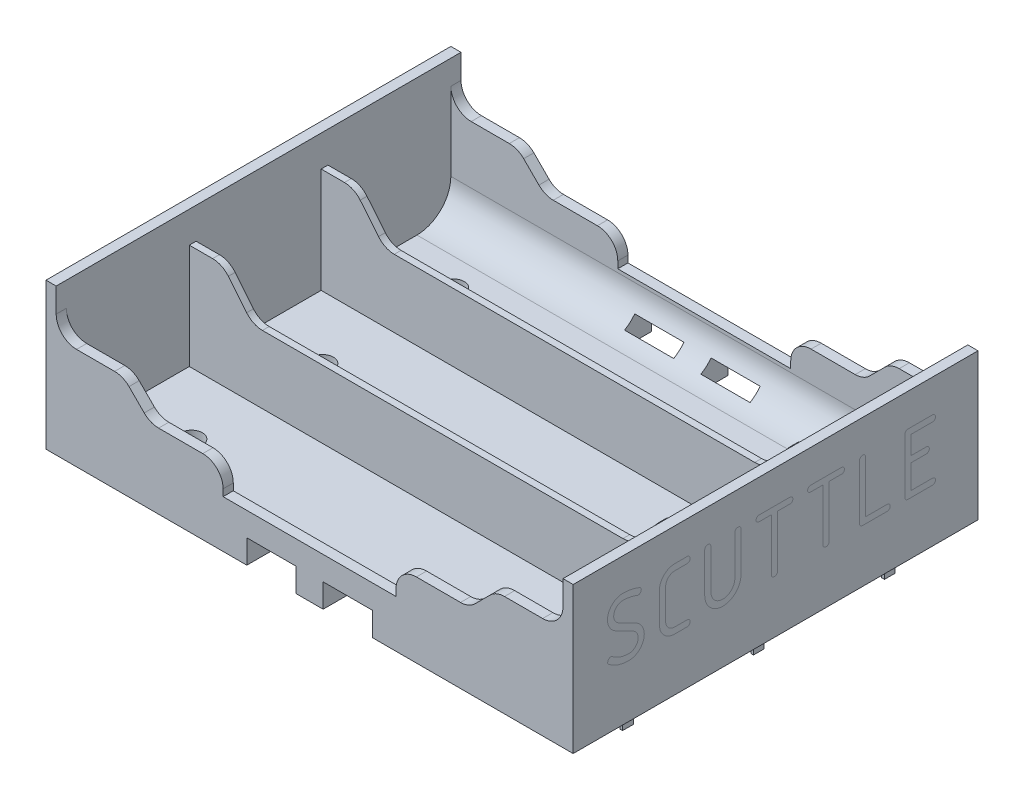
from build123d import *

# Parameters (mm, degrees)
SKETCH1_W                 = 77.724
SKETCH1_H                 = 59.69
BOSS_EXTRUDE1_DEPTH       = 21.59
SKETCH2_W                 = 0.4064
SKETCH2_H                 = 1.5748
BOSS_EXTRUDE2_DEPTH       = 3.175
SKETCH3_W                 = 0.4064
SKETCH3_H                 = 1.5748
BOSS_EXTRUDE3_DEPTH       = 3.175
SKETCH4_W                 = 0.4064
SKETCH4_H                 = 1.5748
BOSS_EXTRUDE4_DEPTH       = 3.175
SKETCH5_W                 = 0.4064
SKETCH5_H                 = 1.5748
BOSS_EXTRUDE5_DEPTH       = 3.175
SKETCH6_W                 = 0.4064
SKETCH6_H                 = 1.5748
BOSS_EXTRUDE6_DEPTH       = 3.175
SKETCH7_W                 = 0.4064
SKETCH7_H                 = 1.5748
BOSS_EXTRUDE7_DEPTH       = 3.175
F_4_CLEARANCE_HOLE1_D     = 3.2004
F_4_CLEARANCE_HOLE1_DEPTH = 5.08
SHELL1_START              = 1.5
SHELL1_OUTLINE_W          = 74.724
SHELL1_OUTLINE_H          = 56.69
SHELL1_OUTLINE_R          = 3.1002
SHELL1_DEPTH              = 20.09
SHELL1_START_2            = 6.58
SHELL1_2_OUTLINE_R        = 3.1002
SHELL1_2_DEPTH            = 15.01
FILLET1_R                 = 5
CUT_EXTRUDE3_DEPTH        = 75.426334345
SKETCH11_W                = 74.724
SKETCH11_H                = 46.69
CUT_EXTRUDE4_DEPTH        = 53.958353156
SKETCH12_W                = 74.724
SKETCH12_H                = 1
BOSS_EXTRUDE8_DEPTH       = 15.5
CUT_EXTRUDE5_REACH        = 61.182
FILLET2_R                 = 3
SKETCH14_R                = 1.905686258
CUT_EXTRUDE6_DEPTH        = 0.2
LPATTERN1_COUNT           = 3
LPATTERN1_PITCH           = 17.5
SKETCH16_W                = 7.25
SKETCH16_H                = 4
CUT_EXTRUDE7_DEPTH        = 3.5


# Read off the part's stored shape, not the designer's step: Shell1
with BuildPart() as part:
    # Sketch1 → Boss-Extrude1 (new body)
    with BuildSketch(Plane.XZ):
        Rectangle(SKETCH1_W, SKETCH1_H)
    extrude(amount=-BOSS_EXTRUDE1_DEPTH)

    # Sketch2 → Boss-Extrude2 (add)
    with BuildSketch(Plane.XZ):
        with Locations((-36.195, 0)):
            Rectangle(SKETCH2_W, SKETCH2_H)
    extrude(amount=BOSS_EXTRUDE2_DEPTH)

    # Sketch3 → Boss-Extrude3 (add)
    with BuildSketch(Plane.XZ):
        with Locations((36.195, 0)):
            Rectangle(SKETCH3_W, SKETCH3_H)
    extrude(amount=BOSS_EXTRUDE3_DEPTH)

    # Sketch4 → Boss-Extrude4 (add)
    with BuildSketch(Plane.XZ):
        with Locations((-36.195, 19.304)):
            Rectangle(SKETCH4_W, SKETCH4_H)
    extrude(amount=BOSS_EXTRUDE4_DEPTH)

    # Sketch5 → Boss-Extrude5 (add)
    with BuildSketch(Plane.XZ):
        with Locations((36.195, 19.304)):
            Rectangle(SKETCH5_W, SKETCH5_H)
    extrude(amount=BOSS_EXTRUDE5_DEPTH)

    # Sketch6 → Boss-Extrude6 (add)
    with BuildSketch(Plane.XZ):
        with Locations((36.195, -19.304)):
            Rectangle(SKETCH6_W, SKETCH6_H)
    extrude(amount=BOSS_EXTRUDE6_DEPTH)

    # Sketch7 → Boss-Extrude7 (add)
    with BuildSketch(Plane.XZ):
        with Locations((-36.195, -19.304)):
            Rectangle(SKETCH7_W, SKETCH7_H)
    extrude(amount=BOSS_EXTRUDE7_DEPTH)

    # #4 Clearance Hole1
    with Locations(Plane(origin=(0, 0, 0), x_dir=(-1, 0, 0), z_dir=(0, -1, 0))):
        with Locations((27.94, 19.304), (27.94, 0), (-27.686, 19.304), (-27.686, 0), (-27.686, -19.304), (27.94, -19.304)):
            Hole(F_4_CLEARANCE_HOLE1_D / 2, depth=F_4_CLEARANCE_HOLE1_DEPTH)

    # Shell1 outline → Shell1 (cut)
    with BuildSketch(Plane(origin=(0, 0, 0), x_dir=(1, 0, 0), z_dir=(0, 1, 0)).offset(SHELL1_START)):
        Rectangle(SHELL1_OUTLINE_W, SHELL1_OUTLINE_H)
        with Locations((-27.94, -19.304)):
            Circle(SHELL1_OUTLINE_R, mode=Mode.SUBTRACT)
        with Locations((-27.94, 0)):
            Circle(SHELL1_OUTLINE_R, mode=Mode.SUBTRACT)
        with Locations((27.686, -19.304)):
            Circle(SHELL1_OUTLINE_R, mode=Mode.SUBTRACT)
        with Locations((27.686, 0)):
            Circle(SHELL1_OUTLINE_R, mode=Mode.SUBTRACT)
        with Locations((-27.94, 19.304)):
            Circle(SHELL1_OUTLINE_R, mode=Mode.SUBTRACT)
        with Locations((27.686, 19.304)):
            Circle(SHELL1_OUTLINE_R, mode=Mode.SUBTRACT)
    extrude(amount=SHELL1_DEPTH, mode=Mode.SUBTRACT)

    # Shell1 2 outline → Shell1 2 (cut)
    with BuildSketch(Plane(origin=(0, 0, 0), x_dir=(1, 0, 0), z_dir=(0, 1, 0)).offset(SHELL1_START_2)):
        with Locations((-27.94, -19.304)):
            Circle(SHELL1_2_OUTLINE_R)
        with Locations((27.686, -19.304)):
            Circle(SHELL1_2_OUTLINE_R)
        with Locations((27.686, 0)):
            Circle(SHELL1_2_OUTLINE_R)
        with Locations((27.686, 19.304)):
            Circle(SHELL1_2_OUTLINE_R)
        with Locations((-27.94, 0)):
            Circle(SHELL1_2_OUTLINE_R)
        with Locations((-27.94, 19.304)):
            Circle(SHELL1_2_OUTLINE_R)
    extrude(amount=SHELL1_2_DEPTH, mode=Mode.SUBTRACT)

    # Fillet1
    fillet1_edges = [part.edges().sort_by_distance(p)[0] for p in [
        (0, 1.5, 28.345),
        (0, 1.5, -28.345),
    ]]
    fillet(fillet1_edges, radius=FILLET1_R)

    # Sketch10 → Cut-Extrude3 (cut, through all)
    with BuildSketch(Plane(origin=(0, 0, -29.845), x_dir=(-1, 0, 0), z_dir=(0, 0, -1))):
        Polygon((0, 7), (12.75, 7), (12.75, 11), (23.5, 11), (27.5, 15), (37.362, 15), (37.362, 21.59), (0, 21.59), align=None)
    cut_extrude3 = extrude(amount=-CUT_EXTRUDE3_DEPTH, mode=Mode.SUBTRACT)

    # Mirror1: Cut-Extrude3 across plane
    add(cut_extrude3.mirror(Plane(origin=(0, 0, 0), x_dir=(0, 0, 1), z_dir=(1, 0, 0))), mode=Mode.SUBTRACT)

    # Sketch11 → Cut-Extrude4 (cut, through all)
    with BuildSketch(Plane(origin=(0, 1.5, 0), x_dir=(1, 0, 0), z_dir=(0, 1, 0))):
        Rectangle(SKETCH11_W, SKETCH11_H)
    extrude(amount=CUT_EXTRUDE4_DEPTH, mode=Mode.SUBTRACT)

    # Sketch12 → Boss-Extrude8 (add)
    with BuildSketch(Plane(origin=(0, 1.5, 0), x_dir=(1, 0, 0), z_dir=(0, 1, 0))):
        with Locations((0, 9.72)):
            Rectangle(SKETCH12_W, SKETCH12_H)
    boss_extrude8 = extrude(amount=BOSS_EXTRUDE8_DEPTH)

    # Sketch13 → Cut-Extrude5 (cut, up to next)
    with BuildSketch(Plane.XY.offset(-9.22), mode=Mode.PRIVATE) as cut_extrude5_sk1:
        Polygon((-32.5, 17), (-28, 11.5), (28, 11.5), (32.5, 17), align=None)
    cut_extrude5_tool1 = extrude(cut_extrude5_sk1.sketch, amount=-CUT_EXTRUDE5_REACH, mode=Mode.PRIVATE) & part.part
    cut_extrude5 = cut_extrude5_tool1.solids().sort_by_distance((0, 14.318182, -9.22))[0]
    add(cut_extrude5, mode=Mode.SUBTRACT)

    # Mirror2: Boss-Extrude8, Cut-Extrude5 across plane
    add(boss_extrude8.mirror(Plane.XY))
    add(cut_extrude5.mirror(Plane.XY), mode=Mode.SUBTRACT)

    # Fillet2
    fillet2_edges = [part.edges().sort_by_distance(p)[0] for p in [
        (-27.5, 15, 29.095),
        (-27.5, 15, -29.095),
        (-23.5, 11, 29.095),
        (-23.5, 11, -29.095),
        (-12.75, 11, 29.095),
        (-12.75, 11, -29.095),
        (-37.362, 15, 29.095),
        (-37.362, 15, -29.095),
        (12.75, 11, 29.095),
        (12.75, 11, -29.095),
        (23.5, 11, 29.095),
        (23.5, 11, -29.095),
        (37.362, 15, 29.095),
        (37.362, 15, -29.095),
        (27.5, 15, 29.095),
        (27.5, 15, -29.095),
        (-32.5, 17, -9.72),
        (32.5, 17, -9.72),
        (28, 11.5, -9.72),
        (-28, 11.5, -9.72),
        (32.5, 17, 9.72),
        (-32.5, 17, 9.72),
        (-28, 11.5, 9.72),
        (28, 11.5, 9.72),
    ]]
    fillet(fillet2_edges, radius=FILLET2_R)

    # Sketch14 → Cut-Extrude6 (cut)
    with BuildSketch(Plane(origin=(0, 1.5, 0), x_dir=(1, 0, 0), z_dir=(0, 1, 0))):
        with Locations(Location((21.159931599, 16.535374869, 0), (0, 0, 270))):
            Circle(SKETCH14_R)
        Polygon((20.972468472, 16.692908218), (20.972468472, 17.7249595), (21.286571036, 17.7249595), (21.286571036, 16.692908218), (22.318622318, 16.692908218), (22.318622318, 16.378805654), (21.286571036, 16.378805654), (21.286571036, 15.346754372), (20.972468472, 15.346754372), (20.972468472, 16.378805654), (19.94041719, 16.378805654), (19.94041719, 16.692908218), align=None, mode=Mode.SUBTRACT)
    cut_extrude6 = extrude(amount=-CUT_EXTRUDE6_DEPTH, mode=Mode.SUBTRACT)

    # LPattern1: Cut-Extrude6 ×3
    with Locations(*[(0, 0, i * LPATTERN1_PITCH) for i in range(1, LPATTERN1_COUNT)]):
        add(cut_extrude6, mode=Mode.SUBTRACT)

    # Sketch16 → Cut-Extrude7 (cut)
    with BuildSketch(Plane.XZ):
        with Locations((-5.625, 27.845)):
            Rectangle(SKETCH16_W, SKETCH16_H)
        with Locations((5.625, 27.845)):
            Rectangle(SKETCH16_W, SKETCH16_H)
    cut_extrude7 = extrude(amount=-CUT_EXTRUDE7_DEPTH, mode=Mode.SUBTRACT)

    # Mirror3: Cut-Extrude7 across plane
    add(cut_extrude7.mirror(Plane.XY), mode=Mode.SUBTRACT)


solid = part.part
